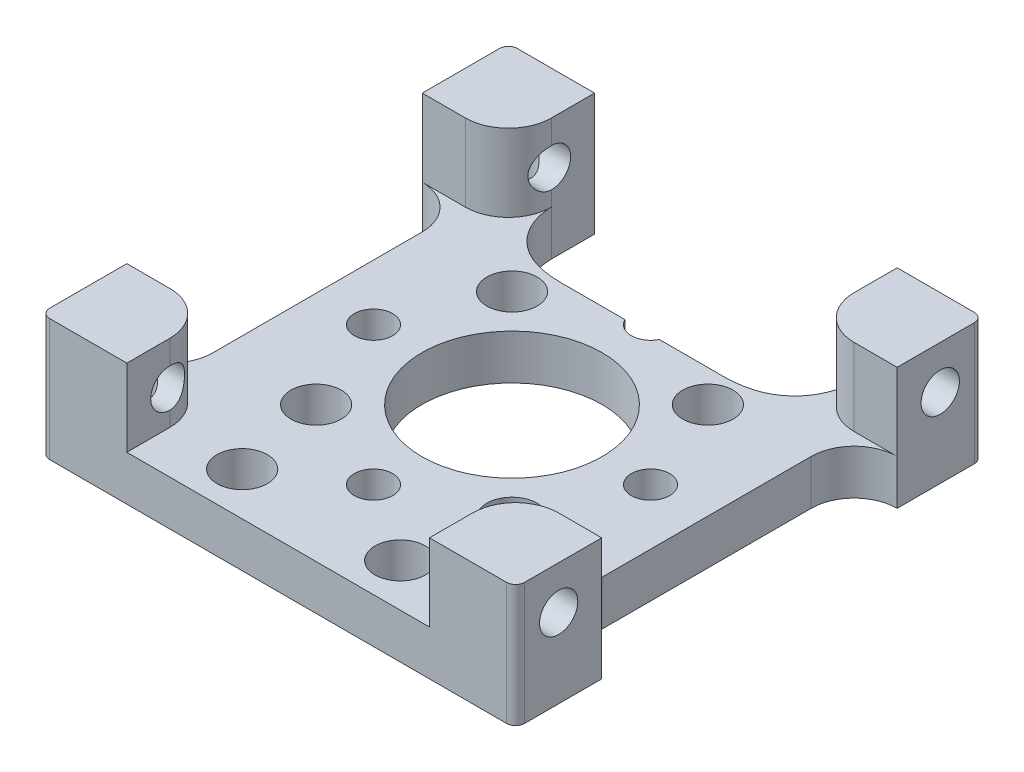
from build123d import *

# Parameters (mm, degrees)
SKETCH1_W                   = 33.528
SKETCH1_H                   = 33.02
BOSS_EXTRUDE1_DEPTH         = 3.175
CUT_EXTRUDE1_DEPTH          = 24.742207585
CUT_EXTRUDE2_DEPTH          = 24.742207585
SKETCH4_W                   = 6.08076
SKETCH4_H                   = 5.45338
BOSS_EXTRUDE2_DEPTH         = 6.08076
SKETCH5_W                   = 6.08076
SKETCH5_H                   = 5.45338
BOSS_EXTRUDE3_DEPTH         = 6.08076
SKETCH6_W                   = 6.08076
SKETCH6_H                   = 5.45338
BOSS_EXTRUDE4_DEPTH         = 6.08076
SKETCH7_W                   = 6.08076
SKETCH7_H                   = 5.45338
BOSS_EXTRUDE5_DEPTH         = 6.08076
HOLE1_D                     = 12.7254
M2_5_CLEARANCE_HOLE1_D      = 2.7051
M3_CLEARANCE_HOLE1_D        = 3.556
M2_5_CLEARANCE_HOLE2_D      = 2.7051
M2_5_CLEARANCE_HOLE2_DEPTH  = 39.60876
M2_5_CLEARANCE_HOLE3_D      = 2.7051
M2_5_CLEARANCE_HOLE3_DEPTH  = 39.60876
M2_5_CLEARANCE_HOLE4_REACH  = 27.061
M2_5_CLEARANCE_HOLE4_BORE_R = 1.35255
FILLET1_R                   = 0.635
FILLET2_R                   = 3.04038
CUT_EXTRUDE3_REACH          = 26.153


with BuildPart() as part:
    # Sketch1 → Boss-Extrude1 (new body)
    with BuildSketch(Plane(origin=(0, 3.175, 0), x_dir=(1, 0, 0), z_dir=(0, 1, 0))):
        Rectangle(SKETCH1_W, SKETCH1_H)
    extrude(amount=-BOSS_EXTRUDE1_DEPTH)

    # Sketch2 → Cut-Extrude1 (cut, through all)
    with BuildSketch(Plane.XZ):
        with BuildLine():
            Line((16.764, -10.42924), (16.764, 10.42924))
            ThreePointArc((16.764, 10.42924), (14.617411383, 9.536940757), (13.7287, 7.388864244))
            Line((13.7287, 7.388864244), (13.7287, -7.388864244))
            ThreePointArc((13.7287, -7.388864244), (14.617411383, -9.536940757), (16.764, -10.42924))
        make_face()
    extrude(amount=-CUT_EXTRUDE1_DEPTH, mode=Mode.SUBTRACT)

    # Sketch3 → Cut-Extrude2 (cut, through all)
    with BuildSketch(Plane.XZ):
        with BuildLine():
            Line((-16.764, 10.42924), (-16.764, -10.42924))
            ThreePointArc((-16.764, -10.42924), (-14.617411383, -9.536940757), (-13.7287, -7.388864244))
            Line((-13.7287, -7.388864244), (-13.7287, 7.388864244))
            ThreePointArc((-13.7287, 7.388864244), (-14.617411383, 9.536940757), (-16.764, 10.42924))
        make_face()
    extrude(amount=-CUT_EXTRUDE2_DEPTH, mode=Mode.SUBTRACT)

    # Sketch4 → Boss-Extrude2 (add)
    with BuildSketch(Plane(origin=(0, 0, -16.51), x_dir=(-1, 0, 0), z_dir=(0, 0, -1))):
        with Locations((13.72362, 5.90169)):
            Rectangle(SKETCH4_W, SKETCH4_H)
    extrude(amount=-BOSS_EXTRUDE2_DEPTH)

    # Sketch5 → Boss-Extrude3 (add)
    with BuildSketch(Plane(origin=(0, 0, -16.51), x_dir=(-1, 0, 0), z_dir=(0, 0, -1))):
        with Locations((-13.72362, 5.90169)):
            Rectangle(SKETCH5_W, SKETCH5_H)
    extrude(amount=-BOSS_EXTRUDE3_DEPTH)

    # Sketch6 → Boss-Extrude4 (add)
    with BuildSketch(Plane.XY.offset(16.51)):
        with Locations((13.72362, 5.90169)):
            Rectangle(SKETCH6_W, SKETCH6_H)
    extrude(amount=-BOSS_EXTRUDE4_DEPTH)

    # Sketch7 → Boss-Extrude5 (add)
    with BuildSketch(Plane.XY.offset(16.51)):
        with Locations((-13.72362, 5.90169)):
            Rectangle(SKETCH7_W, SKETCH7_H)
    extrude(amount=-BOSS_EXTRUDE5_DEPTH)

    # Hole1 (through all)
    with Locations(Plane(origin=(0, 3.175, 0), x_dir=(1, 0, 0), z_dir=(0, 1, 0))):
        with Locations((0, 0)):
            Hole(HOLE1_D / 2)

    # M2.5 Clearance Hole1 (through all)
    with Locations(Plane(origin=(0, 3.175, 0), x_dir=(1, 0, 0), z_dir=(0, 1, 0))):
        with Locations((0, 9.779), (-9.779, 0), (0, -9.779), (9.779, 0)):
            Hole(M2_5_CLEARANCE_HOLE1_D / 2)

    # M3 Clearance Hole1 (through all)
    with Locations(Plane(origin=(0, 3.175, 0), x_dir=(1, 0, 0), z_dir=(0, 1, 0))):
        with Locations((-5.579615818, -13.470384182), (5.579615818, -13.470384182), (5.579615818, 13.470384182), (-5.579615818, 13.470384182), (6.914797213, 6.914797213), (-6.914797213, 6.914797213), (-6.914797213, -6.914797213), (6.914797213, -6.914797213)):
            Hole(M3_CLEARANCE_HOLE1_D / 2)

    # M2.5 Clearance Hole2
    with Locations(Plane(origin=(16.764, 0, 0), x_dir=(0, 0, -1), z_dir=(1, 0, 0))):
        with Locations((-13.470384182, 5.588)):
            Hole(M2_5_CLEARANCE_HOLE2_D / 2, depth=M2_5_CLEARANCE_HOLE2_DEPTH)

    # M2.5 Clearance Hole3
    with Locations(Plane.ZY.offset(16.764)):
        with Locations((-13.470384182, 5.588)):
            Hole(M2_5_CLEARANCE_HOLE3_D / 2, depth=M2_5_CLEARANCE_HOLE3_DEPTH)

    # M2.5 Clearance Hole4 bore → M2.5 Clearance Hole4 (cut, up to next)
    with BuildSketch(Plane(origin=(0, 0, 0), x_dir=(-1, 0, 0), z_dir=(0, -1, 0)), mode=Mode.PRIVATE) as m2_5_clearance_hole4_sk1:
        with Locations((13.470384182, 13.470384182)):
            Circle(M2_5_CLEARANCE_HOLE4_BORE_R)
    m2_5_clearance_hole4_tool1 = extrude(m2_5_clearance_hole4_sk1.sketch, amount=-M2_5_CLEARANCE_HOLE4_REACH, mode=Mode.PRIVATE) & part.part
    # M2.5 Clearance Hole4 bore → M2.5 Clearance Hole4 (cut, up to next)
    with BuildSketch(Plane(origin=(0, 0, 0), x_dir=(-1, 0, 0), z_dir=(0, -1, 0)), mode=Mode.PRIVATE) as m2_5_clearance_hole4_sk2:
        with Locations((-13.470384182, 13.470384182)):
            Circle(M2_5_CLEARANCE_HOLE4_BORE_R)
    m2_5_clearance_hole4_tool2 = extrude(m2_5_clearance_hole4_sk2.sketch, amount=-M2_5_CLEARANCE_HOLE4_REACH, mode=Mode.PRIVATE) & part.part
    # M2.5 Clearance Hole4 bore → M2.5 Clearance Hole4 (cut, up to next)
    with BuildSketch(Plane(origin=(0, 0, 0), x_dir=(-1, 0, 0), z_dir=(0, -1, 0)), mode=Mode.PRIVATE) as m2_5_clearance_hole4_sk3:
        with Locations((-13.470384182, -13.470384182)):
            Circle(M2_5_CLEARANCE_HOLE4_BORE_R)
    m2_5_clearance_hole4_tool3 = extrude(m2_5_clearance_hole4_sk3.sketch, amount=-M2_5_CLEARANCE_HOLE4_REACH, mode=Mode.PRIVATE) & part.part
    # M2.5 Clearance Hole4 bore → M2.5 Clearance Hole4 (cut, up to next)
    with BuildSketch(Plane(origin=(0, 0, 0), x_dir=(-1, 0, 0), z_dir=(0, -1, 0)), mode=Mode.PRIVATE) as m2_5_clearance_hole4_sk4:
        with Locations((13.470384182, -13.470384182)):
            Circle(M2_5_CLEARANCE_HOLE4_BORE_R)
    m2_5_clearance_hole4_tool4 = extrude(m2_5_clearance_hole4_sk4.sketch, amount=-M2_5_CLEARANCE_HOLE4_REACH, mode=Mode.PRIVATE) & part.part
    add(m2_5_clearance_hole4_tool1.solids().sort_by_distance((-13.470384, 0, -13.470384))[0], mode=Mode.SUBTRACT)
    add(m2_5_clearance_hole4_tool2.solids().sort_by_distance((13.470384, 0, -13.470384))[0], mode=Mode.SUBTRACT)
    add(m2_5_clearance_hole4_tool3.solids().sort_by_distance((13.470384, 0, 13.470384))[0], mode=Mode.SUBTRACT)
    add(m2_5_clearance_hole4_tool4.solids().sort_by_distance((-13.470384, 0, 13.470384))[0], mode=Mode.SUBTRACT)

    # Fillet1
    fillet1_edges = [part.edges().sort_by_distance(p)[0] for p in [
        (-16.764, 4.31419, 16.51),
        (-16.764, 4.31419, -16.51),
        (16.764, 4.31419, -16.51),
        (16.764, 4.31419, 16.51),
    ]]
    fillet(fillet1_edges, radius=FILLET1_R)

    # Fillet2
    # the kernel refuses this fillet: 3.04038 mm, written as the material it takes off along each edge
    with BuildSketch(Plane(origin=(-10.68324, 16.22933, -10.42924), x_dir=(-1, 0, 0), z_dir=(0, -1, 0)), Plane(origin=(10.68324, 16.22933, 10.42924), x_dir=(1, 0, 0), z_dir=(0, -1, 0)), Plane(origin=(-10.68324, 3.175, 10.42924), x_dir=(-1, 0, 0), z_dir=(0, 1, 0))) as fillet2_piece_1:
        with BuildLine():
            CenterArc((FILLET2_R, FILLET2_R), FILLET2_R, 180, 90)
            Line((0, FILLET2_R), (0, 0))
            Line((0, 0), (FILLET2_R, 0))
        make_face()
    extrude(amount=13.05433, mode=Mode.SUBTRACT)
    with BuildSketch(Plane(origin=(10.68324, 3.175, -10.42924), x_dir=(0, 0, -1), z_dir=(0, 1, 0))) as fillet2_piece_2:
        with BuildLine():
            CenterArc((FILLET2_R, -FILLET2_R), FILLET2_R, 90, 90)
            Line((0, -FILLET2_R), (0, 0))
            Line((0, 0), (FILLET2_R, 0))
        make_face()
    extrude(amount=13.05433, mode=Mode.SUBTRACT)

    # Sketch20 → Cut-Extrude3 (cut, up to next)
    with BuildSketch(Plane(origin=(0, 3.175, 0), x_dir=(1, 0, 0), z_dir=(0, 1, 0)), mode=Mode.PRIVATE) as cut_extrude3_sk1:
        with BuildLine():
            Line((5.815146261, 9.186050919), (-5.815146261, 9.186050919))
            ThreePointArc((-5.815146261, 9.186050919), (-6.754288773, 9.253077351), (-7.674393598, 9.452797931))
            ThreePointArc((-7.674393598, 9.452797931), (-9.84761666, 10.960236799), (-10.68324, 13.46962))
            Line((-10.68324, 13.46962), (-10.68324, 16.51))
            Line((-10.68324, 16.51), (10.68324, 16.51))
            Line((10.68324, 16.51), (10.68324, 13.46962))
            ThreePointArc((10.68324, 13.46962), (9.84761666, 10.960236799), (7.674393598, 9.452797931))
            ThreePointArc((7.674393598, 9.452797931), (6.754288773, 9.253077351), (5.815146261, 9.186050919))
        make_face()
    cut_extrude3_tool1 = extrude(cut_extrude3_sk1.sketch, amount=-CUT_EXTRUDE3_REACH, mode=Mode.PRIVATE) & part.part
    add(cut_extrude3_tool1.solids().sort_by_distance((0, 3.175, -13.000619))[0], mode=Mode.SUBTRACT)


solid = part.part
